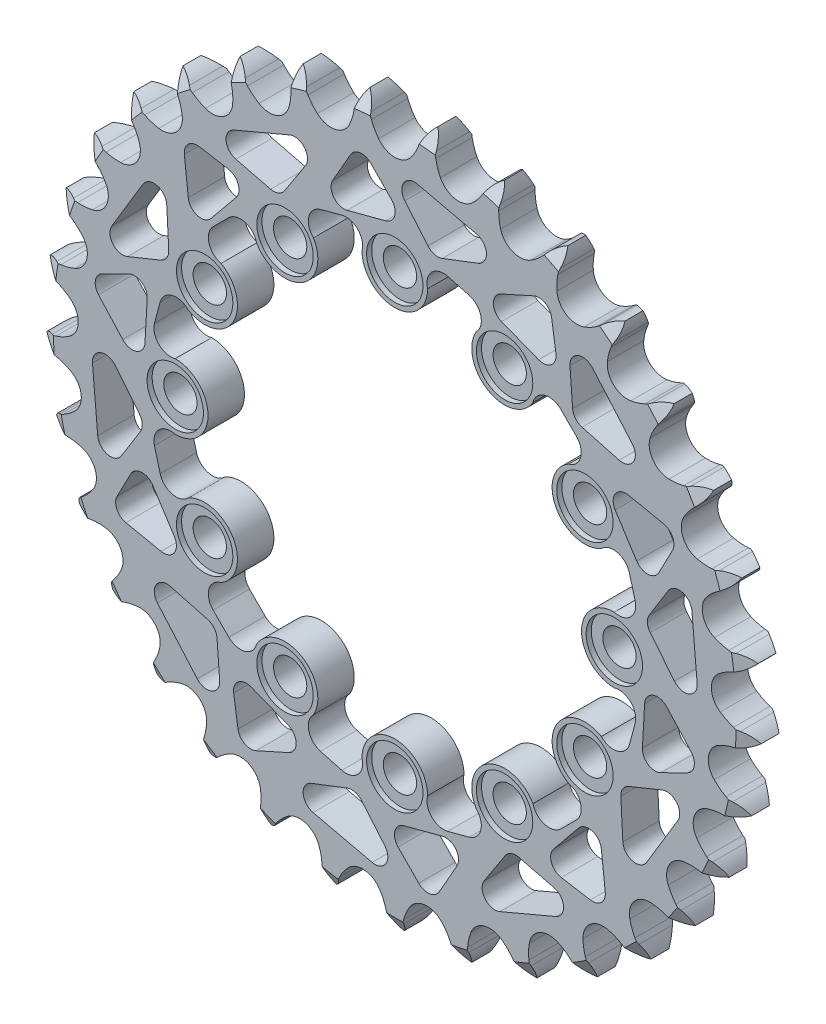
from build123d import *

# Parameters (mm, degrees)
EXTRUSION_DEPTH         = 7.2136
CIRPATTERN1_COUNT       = 12
CUT_EXTRUDE1_DEPTH      = 101.397293257
CUT_EXTRUDE1_DEPTH_BACK = 101.397293257
SKETCH8_R               = 37
CUT_EXTRUDE2_START      = 7.2136
SKETCH10_R              = 5.588
CUT_EXTRUDE2_DEPTH      = 1.016
CIRPATTERN2_COUNT       = 12
CUT_EXTRUDE3_DEPTH      = 101.397293405
CIRPATTERN3_COUNT       = 12
CUT_EXTRUDE4_DEPTH      = 101.397293405
CIRPATTERN5_COUNT       = 10


with BuildPart() as part:
    # Teeth Sketch → Extrusion (new body)
    with BuildSketch(Plane.XY):
        with BuildLine():
            ThreePointArc((6.734552875, 70.527428506), (5.727412099, 69.369502295), (5.022388138, 68.006393031))
            Line((5.022388138, 68.006393031), (4.635162245, 66.971544668))
            ThreePointArc((4.635162245, 66.971544668), (4.0137299, 65.635158722), (3.209237245, 64.400291471))
            ThreePointArc((3.209237245, 64.400291471), (0, 62.793862006), (-3.209237245, 64.400291471))
            ThreePointArc((-3.209237245, 64.400291471), (-4.0137299, 65.635158722), (-4.635162245, 66.971544668))
            Line((-4.635162245, 66.971544668), (-5.022388138, 68.006393031))
            ThreePointArc((-5.022388138, 68.006393031), (-5.727412099, 69.369502295), (-6.734552875, 70.527428506))
            ThreePointArc((-6.734552875, 70.527428506), (-7.504354329, 69.199824885), (-7.938667464, 67.727922119))
            Line((-7.938667464, 67.727922119), (-8.123049341, 66.638491832))
            ThreePointArc((-8.123049341, 66.638491832), (-8.48033889, 65.208649276), (-9.036593151, 63.84384645))
            ThreePointArc((-9.036593151, 63.84384645), (-11.883816523, 61.659095115), (-15.339077445, 62.629142165))
            ThreePointArc((-15.339077445, 62.629142165), (-16.362732034, 63.68944252), (-17.22584699, 64.884071387))
            Line((-17.22584699, 64.884071387), (-17.801921547, 65.826935709))
            ThreePointArc((-17.801921547, 65.826935709), (-18.752174931, 67.031985151), (-19.960254337, 67.978383482))
            ThreePointArc((-19.960254337, 67.978383482), (-20.464893839, 66.529085505), (-20.61279894, 65.001587639))
            Line((-20.61279894, 65.001587639), (-20.587672758, 63.896950277))
            ThreePointArc((-20.587672758, 63.896950277), (-20.667906137, 62.425329346), (-20.955817525, 60.979918474))
            ThreePointArc((-20.955817525, 60.979918474), (-23.338120953, 58.295807876), (-26.914523421, 58.594412483))
            ThreePointArc((-26.914523421, 58.594412483), (-28.120342399, 59.441823925), (-29.193944743, 60.451518712))
            Line((-29.193944743, 60.451518712), (-29.938047129, 61.268321421))
            ThreePointArc((-29.938047129, 61.268321421), (-31.099185303, 62.271757414), (-32.464540202, 62.972422563))
            ThreePointArc((-32.464540202, 62.972422563), (-32.685778765, 61.453811636), (-32.541930156, 59.925926421))
            Line((-32.541930156, 59.925926421), (-32.308204042, 58.846006456))
            ThreePointArc((-32.308204042, 58.846006456), (-32.108481407, 57.385795366), (-32.117644055, 55.912017363))
            ThreePointArc((-32.117644055, 55.912017363), (-33.948924886, 52.825558252), (-37.517208396, 52.441928068))
            ThreePointArc((-37.517208396, 52.441928068), (-38.861610323, 53.045822938), (-40.106897269, 53.834090646))
            Line((-40.106897269, 53.834090646), (-40.992133685, 54.495310364))
            ThreePointArc((-40.992133685, 54.495310364), (-42.32219009, 55.260866117), (-43.795472998, 55.69047422))
            ThreePointArc((-43.795472998, 55.69047422), (-43.725314484, 54.157436897), (-43.294911229, 52.684386087))
            Line((-43.294911229, 52.684386087), (-42.861032653, 51.668214641))
            ThreePointArc((-42.861032653, 51.668214641), (-42.388572501, 50.272189225), (-42.118655247, 48.823310267))
            ThreePointArc((-42.118655247, 48.823310267), (-43.33272622, 45.446055318), (-46.763923708, 44.394055736))
            ThreePointArc((-46.763923708, 44.394055736), (-48.198318397, 44.732607702), (-49.570282031, 45.270958281))
            Line((-49.570282031, 45.270958281), (-50.564657725, 45.752696804))
            ThreePointArc((-50.564657725, 45.752696804), (-52.015560657, 46.252703137), (-53.543523293, 46.395727039))
            ThreePointArc((-53.543523293, 46.395727039), (-53.184503413, 44.903671283), (-52.483101407, 43.538694772))
            Line((-52.483101407, 43.538694772), (-51.864751871, 42.622998928))
            ThreePointArc((-51.864751871, 42.622998928), (-51.136630142, 41.341615182), (-50.597388499, 39.970001531))
            ThreePointArc((-50.597388499, 39.970001531), (-51.150369926, 36.424013535), (-54.320468976, 34.741666562))
            ThreePointArc((-54.320468976, 34.741666562), (-55.793013665, 34.802639473), (-57.242067645, 35.071615531))
            Line((-57.242067645, 35.071615531), (-58.309643291, 35.356461573))
            ThreePointArc((-58.309643291, 35.356461573), (-59.828953337, 35.572846956), (-61.356371149, 35.424117399))
            ThreePointArc((-61.356371149, 35.424117399), (-60.721465817, 34.026969994), (-59.774415556, 32.819401589))
            Line((-59.774415556, 32.819401589), (-58.993943824, 32.037276981))
            ThreePointArc((-58.993943824, 32.037276981), (-58.036476735, 30.916847451), (-57.2474003, 29.672072798))
            ThreePointArc((-57.2474003, 29.672072798), (-57.119305992, 26.085513002), (-59.913730964, 23.83362304))
            ThreePointArc((-59.913730964, 23.83362304), (-61.371204052, 23.614813176), (-62.844975793, 23.604693218))
            Line((-62.844975793, 23.604693218), (-63.947166423, 23.682351702))
            ThreePointArc((-63.947166423, 23.682351702), (-65.479971761, 23.607295402), (-66.951639889, 23.17218786))
            ThreePointArc((-66.951639889, 23.17218786), (-66.063796239, 21.920445353), (-64.905326586, 20.913929722))
            Line((-64.905326586, 20.913929722), (-63.99094094, 20.293644371))
            ThreePointArc((-63.99094094, 20.293644371), (-62.838733846, 19.374664301), (-61.828341898, 18.301718044))
            ThreePointArc((-61.828341898, 18.301718044), (-61.023801517, 14.804214063), (-63.341554612, 12.064170283))
            ThreePointArc((-63.341554612, 12.064170283), (-64.731279223, 11.573486003), (-66.176502774, 11.28463579))
            Line((-66.176502774, 11.28463579), (-67.273472348, 11.152299936))
            ThreePointArc((-67.273472348, 11.152299936), (-68.764373399, 10.788514683), (-70.127101923, 10.082755077))
            ThreePointArc((-70.127101923, 10.082755077), (-69.018408937, 9.021658703), (-67.690390004, 8.252573944))
            Line((-67.690390004, 8.252573944), (-66.675138724, 7.816546579))
            ThreePointArc((-66.675138724, 7.816546579), (-65.369835391, 7.132230303), (-64.174646128, 6.269891516))
            ThreePointArc((-64.174646128, 6.269891516), (-62.722737859, 2.987852256), (-64.480049441, -0.14131302))
            ThreePointArc((-64.480049441, -0.14131302), (-65.751797307, -0.886137108), (-67.116238523, -1.443277777))
            Line((-67.116238523, -1.443277777), (-68.168339704, -1.780825007))
            ThreePointArc((-68.168339704, -1.780825007), (-69.563451418, -2.420191065), (-70.767987779, -3.371094744))
            ThreePointArc((-70.767987779, -3.371094744), (-69.478516511, -4.203194198), (-68.028946362, -4.707051357))
            Line((-68.028946362, -4.707051357), (-66.949523274, -4.943061572))
            ThreePointArc((-66.949523274, -4.943061572), (-65.538300765, -5.367981082), (-64.201511441, -5.988545228))
            ThreePointArc((-64.201511441, -5.988545228), (-62.154711032, -8.936498316), (-63.288067282, -12.341688903))
            ThreePointArc((-63.288067282, -12.341688903), (-64.395874122, -13.313732915), (-65.630218543, -14.119027525))
            Line((-65.630218543, -14.119027525), (-66.599425651, -14.649586294))
            ThreePointArc((-66.599425651, -14.649586294), (-67.848325057, -15.541424803), (-68.851134172, -16.703104419))
            ThreePointArc((-68.851134172, -16.703104419), (-67.427489473, -17.276132709), (-65.908759351, -17.496551559))
            Line((-65.908759351, -17.496551559), (-64.804177617, -17.524014599))
            ThreePointArc((-64.804177617, -17.524014599), (-63.338041192, -17.674179644), (-61.907966855, -18.030540344))
            ThreePointArc((-61.907966855, -18.030540344), (-59.340251006, -20.537860555), (-59.808689476, -24.096003993))
            ThreePointArc((-59.808689476, -24.096003993), (-60.712516265, -25.260135726), (-61.772151467, -26.284478831))
            Line((-61.772151467, -26.284478831), (-62.623434833, -26.988873364))
            ThreePointArc((-62.623434833, -26.988873364), (-63.680983452, -28.100950955), (-64.445821187, -29.43142038))
            ThreePointArc((-64.445821187, -29.43142038), (-62.939457285, -29.724666771), (-61.406458053, -29.6536808))
            Line((-61.406458053, -29.6536808), (-60.316640136, -29.471604079))
            ThreePointArc((-60.316640136, -29.471604079), (-58.848579784, -29.341587304), (-57.376907048, -29.420864754))
            ThreePointArc((-57.376907048, -29.420864754), (-54.381079699, -31.396931003), (-54.167669802, -34.979426717))
            ThreePointArc((-54.167669802, -34.979426717), (-54.834849884, -36.293571418), (-55.681477891, -37.499940589))
            Line((-55.681477891, -37.499940589), (-56.384069915, -38.352712231))
            ThreePointArc((-56.384069915, -38.352712231), (-57.212045185, -39.644835523), (-57.711268312, -41.096008126))
            ThreePointArc((-57.711268312, -41.096008126), (-56.176629123, -41.09887393), (-54.684767369, -40.739048756))
            Line((-54.684767369, -40.739048756), (-53.649102126, -40.354013001))
            ThreePointArc((-53.649102126, -40.354013001), (-52.232177374, -39.94851355), (-50.772096325, -39.747842457))
            ThreePointArc((-50.772096325, -39.747842457), (-47.456434483, -41.12123456), (-46.56888941, -44.598601821))
            ThreePointArc((-46.56888941, -44.598601821), (-46.975309158, -46.015262876), (-47.578330627, -47.360056788))
            Line((-47.578330627, -47.360056788), (-48.106837804, -48.330384151))
            ThreePointArc((-48.106837804, -48.330384151), (-48.675314541, -49.755852442), (-48.890879835, -51.275279063))
            ThreePointArc((-48.890879835, -51.275279063), (-47.383431219, -50.987660703), (-45.986626711, -50.352001344))
            Line((-45.986626711, -50.352001344), (-45.042545785, -49.777922752))
            ThreePointArc((-45.042545785, -49.777922752), (-43.727967985, -49.111596431), (-42.332249756, -48.638229571))
            ThreePointArc((-42.332249756, -48.638229571), (-38.816590078, -49.35930956), (-37.28698802, -52.605867255))
            ThreePointArc((-37.28698802, -52.605867255), (-37.417958367, -54.073842843), (-37.75557853, -55.50845714))
            Line((-37.75557853, -55.50845714), (-38.090899233, -56.561270064))
            ThreePointArc((-38.090899233, -56.561270064), (-38.379331208, -58.068563217), (-38.303447577, -59.601327819))
            ThreePointArc((-38.303447577, -59.601327819), (-36.877672653, -59.03362057), (-35.626409548, -58.145101414))
            Line((-35.626409548, -58.145101414), (-34.808034481, -57.402728679))
            ThreePointArc((-34.808034481, -57.402728679), (-33.6433159, -56.499658259), (-32.362405386, -55.770704343))
            ThreePointArc((-32.362405386, -55.770704343), (-28.773812973, -55.813410509), (-26.657437732, -58.711819583))
            ThreePointArc((-26.657437732, -58.711819583), (-26.508225068, -60.178053241), (-26.568241455, -61.650637225))
            Line((-26.568241455, -61.650637225), (-26.69825632, -62.747884308))
            ThreePointArc((-26.69825632, -62.747884308), (-26.696218847, -64.28252482), (-26.331628924, -65.773229298))
            ThreePointArc((-26.331628924, -65.773229298), (-25.039058915, -64.94595158), (-23.978561119, -63.836686022))
            Line((-23.978561119, -63.836686022), (-23.31547012, -62.952850431))
            ThreePointArc((-23.31547012, -62.952850431), (-22.342706722, -61.845675228), (-21.222899365, -60.887480551))
            ThreePointArc((-21.222899365, -60.887480551), (-17.691075297, -60.250269381), (-15.06441819, -62.69577378))
            ThreePointArc((-15.06441819, -62.69577378), (-14.640415448, -64.107272002), (-14.42065891, -65.564602652))
            Line((-14.42065891, -65.564602652), (-14.340668861, -66.666626525))
            ThreePointArc((-14.340668861, -66.666626525), (-14.048235582, -68.17314849), (-13.408116596, -69.567914899))
            ThreePointArc((-13.408116596, -69.567914899), (-12.295468348, -68.510966685), (-11.464065017, -67.221046473))
            Line((-11.464065017, -67.221046473), (-10.980223921, -66.227692145))
            ThreePointArc((-10.980223921, -66.227692145), (-10.23457391, -64.956428358), (-9.316342465, -63.80362457))
            ThreePointArc((-9.316342465, -63.80362457), (-5.968936066, -62.509526537), (-2.926931324, -64.413739359))
            ThreePointArc((-2.926931324, -64.413739359), (-2.24346307, -65.719486924), (-1.751876179, -67.108892511))
            Line((-1.751876179, -67.108892511), (-1.464772265, -68.175863162))
            ThreePointArc((-1.464772265, -68.175863162), (-0.89251248, -69.59981695), (0, -70.848234798))
            ThreePointArc((0, -70.848234798), (0.89251248, -69.59981695), (1.464772265, -68.175863162))
            Line((1.464772265, -68.175863162), (1.751876179, -67.108892511))
            ThreePointArc((1.751876179, -67.108892511), (2.24346307, -65.719486924), (2.926931324, -64.413739359))
            ThreePointArc((2.926931324, -64.413739359), (5.968936066, -62.509526537), (9.316342465, -63.80362457))
            ThreePointArc((9.316342465, -63.80362457), (10.23457391, -64.956428358), (10.980223921, -66.227692145))
            Line((10.980223921, -66.227692145), (11.464065017, -67.221046473))
            ThreePointArc((11.464065017, -67.221046473), (12.295468348, -68.510966685), (13.408116596, -69.567914899))
            ThreePointArc((13.408116596, -69.567914899), (14.048235582, -68.17314849), (14.340668861, -66.666626525))
            Line((14.340668861, -66.666626525), (14.42065891, -65.564602652))
            ThreePointArc((14.42065891, -65.564602652), (14.640415448, -64.107272002), (15.06441819, -62.69577378))
            ThreePointArc((15.06441819, -62.69577378), (17.691075297, -60.250269381), (21.222899365, -60.887480551))
            ThreePointArc((21.222899365, -60.887480551), (22.342706722, -61.845675228), (23.31547012, -62.952850431))
            Line((23.31547012, -62.952850431), (23.978561119, -63.836686022))
            ThreePointArc((23.978561119, -63.836686022), (25.039058915, -64.94595158), (26.331628924, -65.773229298))
            ThreePointArc((26.331628924, -65.773229298), (26.696218847, -64.28252482), (26.69825632, -62.747884308))
            Line((26.69825632, -62.747884308), (26.568241455, -61.650637225))
            ThreePointArc((26.568241455, -61.650637225), (26.508225068, -60.178053241), (26.657437732, -58.711819583))
            ThreePointArc((26.657437732, -58.711819583), (28.773812973, -55.813410509), (32.362405386, -55.770704343))
            ThreePointArc((32.362405386, -55.770704343), (33.6433159, -56.499658259), (34.808034481, -57.402728679))
            Line((34.808034481, -57.402728679), (35.626409548, -58.145101414))
            ThreePointArc((35.626409548, -58.145101414), (36.877672653, -59.03362057), (38.303447577, -59.601327819))
            ThreePointArc((38.303447577, -59.601327819), (38.379331208, -58.068563217), (38.090899233, -56.561270064))
            Line((38.090899233, -56.561270064), (37.75557853, -55.50845714))
            ThreePointArc((37.75557853, -55.50845714), (37.417958367, -54.073842843), (37.28698802, -52.605867255))
            ThreePointArc((37.28698802, -52.605867255), (38.816590078, -49.35930956), (42.332249756, -48.638229571))
            ThreePointArc((42.332249756, -48.638229571), (43.727967985, -49.111596431), (45.042545785, -49.777922752))
            Line((45.042545785, -49.777922752), (45.986626711, -50.352001344))
            ThreePointArc((45.986626711, -50.352001344), (47.383431219, -50.987660703), (48.890879835, -51.275279063))
            ThreePointArc((48.890879835, -51.275279063), (48.675314541, -49.755852442), (48.106837804, -48.330384151))
            Line((48.106837804, -48.330384151), (47.578330627, -47.360056788))
            ThreePointArc((47.578330627, -47.360056788), (46.975309158, -46.015262876), (46.56888941, -44.598601821))
            ThreePointArc((46.56888941, -44.598601821), (47.456434483, -41.12123456), (50.772096325, -39.747842457))
            ThreePointArc((50.772096325, -39.747842457), (52.232177374, -39.94851355), (53.649102126, -40.354013001))
            Line((53.649102126, -40.354013001), (54.684767369, -40.739048756))
            ThreePointArc((54.684767369, -40.739048756), (56.176629123, -41.09887393), (57.711268312, -41.096008126))
            ThreePointArc((57.711268312, -41.096008126), (57.212045185, -39.644835523), (56.384069915, -38.352712231))
            Line((56.384069915, -38.352712231), (55.681477891, -37.499940589))
            ThreePointArc((55.681477891, -37.499940589), (54.834849884, -36.293571418), (54.167669802, -34.979426717))
            ThreePointArc((54.167669802, -34.979426717), (54.381079699, -31.396931003), (57.376907048, -29.420864754))
            ThreePointArc((57.376907048, -29.420864754), (58.848579784, -29.341587304), (60.316640136, -29.471604079))
            Line((60.316640136, -29.471604079), (61.406458053, -29.6536808))
            ThreePointArc((61.406458053, -29.6536808), (62.939457285, -29.724666771), (64.445821187, -29.43142038))
            ThreePointArc((64.445821187, -29.43142038), (63.680983452, -28.100950955), (62.623434833, -26.988873364))
            Line((62.623434833, -26.988873364), (61.772151467, -26.284478831))
            ThreePointArc((61.772151467, -26.284478831), (60.712516265, -25.260135726), (59.808689476, -24.096003993))
            ThreePointArc((59.808689476, -24.096003993), (59.340251006, -20.537860555), (61.907966855, -18.030540344))
            ThreePointArc((61.907966855, -18.030540344), (63.338041192, -17.674179644), (64.804177617, -17.524014599))
            Line((64.804177617, -17.524014599), (65.908759351, -17.496551559))
            ThreePointArc((65.908759351, -17.496551559), (67.427489473, -17.276132709), (68.851134172, -16.703104419))
            ThreePointArc((68.851134172, -16.703104419), (67.848325057, -15.541424803), (66.599425651, -14.649586294))
            Line((66.599425651, -14.649586294), (65.630218543, -14.119027525))
            ThreePointArc((65.630218543, -14.119027525), (64.395874122, -13.313732915), (63.288067282, -12.341688903))
            ThreePointArc((63.288067282, -12.341688903), (62.154711032, -8.936498316), (64.201511441, -5.988545228))
            ThreePointArc((64.201511441, -5.988545228), (65.538300765, -5.367981082), (66.949523274, -4.943061572))
            Line((66.949523274, -4.943061572), (68.028946362, -4.707051357))
            ThreePointArc((68.028946362, -4.707051357), (69.478516511, -4.203194198), (70.767987779, -3.371094744))
            ThreePointArc((70.767987779, -3.371094744), (69.563451418, -2.420191065), (68.168339704, -1.780825007))
            Line((68.168339704, -1.780825007), (67.116238523, -1.443277777))
            ThreePointArc((67.116238523, -1.443277777), (65.751797307, -0.886137108), (64.480049441, -0.14131302))
            ThreePointArc((64.480049441, -0.14131302), (62.722737859, 2.987852256), (64.174646128, 6.269891516))
            ThreePointArc((64.174646128, 6.269891516), (65.369835391, 7.132230303), (66.675138724, 7.816546579))
            Line((66.675138724, 7.816546579), (67.690390004, 8.252573944))
            ThreePointArc((67.690390004, 8.252573944), (69.018408937, 9.021658703), (70.127101923, 10.082755077))
            ThreePointArc((70.127101923, 10.082755077), (68.764373399, 10.788514683), (67.273472348, 11.152299936))
            Line((67.273472348, 11.152299936), (66.176502774, 11.28463579))
            ThreePointArc((66.176502774, 11.28463579), (64.731279223, 11.573486003), (63.341554612, 12.064170283))
            ThreePointArc((63.341554612, 12.064170283), (61.023801517, 14.804214063), (61.828341898, 18.301718044))
            ThreePointArc((61.828341898, 18.301718044), (62.838733846, 19.374664301), (63.99094094, 20.293644371))
            Line((63.99094094, 20.293644371), (64.905326586, 20.913929722))
            ThreePointArc((64.905326586, 20.913929722), (66.063796239, 21.920445353), (66.951639889, 23.17218786))
            ThreePointArc((66.951639889, 23.17218786), (65.479971761, 23.607295402), (63.947166423, 23.682351702))
            Line((63.947166423, 23.682351702), (62.844975793, 23.604693218))
            ThreePointArc((62.844975793, 23.604693218), (61.371204052, 23.614813176), (59.913730964, 23.83362304))
            ThreePointArc((59.913730964, 23.83362304), (57.119305992, 26.085513002), (57.2474003, 29.672072798))
            ThreePointArc((57.2474003, 29.672072798), (58.036476735, 30.916847451), (58.993943824, 32.037276981))
            Line((58.993943824, 32.037276981), (59.774415556, 32.819401589))
            ThreePointArc((59.774415556, 32.819401589), (60.721465817, 34.026969994), (61.356371149, 35.424117399))
            ThreePointArc((61.356371149, 35.424117399), (59.828953337, 35.572846956), (58.309643291, 35.356461573))
            Line((58.309643291, 35.356461573), (57.242067645, 35.071615531))
            ThreePointArc((57.242067645, 35.071615531), (55.793013665, 34.802639473), (54.320468976, 34.741666562))
            ThreePointArc((54.320468976, 34.741666562), (51.150369926, 36.424013535), (50.597388499, 39.970001531))
            ThreePointArc((50.597388499, 39.970001531), (51.136630142, 41.341615182), (51.864751871, 42.622998928))
            Line((51.864751871, 42.622998928), (52.483101407, 43.538694772))
            ThreePointArc((52.483101407, 43.538694772), (53.184503413, 44.903671283), (53.543523293, 46.395727039))
            ThreePointArc((53.543523293, 46.395727039), (52.015560657, 46.252703137), (50.564657725, 45.752696804))
            Line((50.564657725, 45.752696804), (49.570282031, 45.270958281))
            ThreePointArc((49.570282031, 45.270958281), (48.198318397, 44.732607702), (46.763923708, 44.394055736))
            ThreePointArc((46.763923708, 44.394055736), (43.33272622, 45.446055318), (42.118655247, 48.823310267))
            ThreePointArc((42.118655247, 48.823310267), (42.388572501, 50.272189225), (42.861032653, 51.668214641))
            Line((42.861032653, 51.668214641), (43.294911229, 52.684386087))
            ThreePointArc((43.294911229, 52.684386087), (43.725314484, 54.157436897), (43.795472998, 55.69047422))
            ThreePointArc((43.795472998, 55.69047422), (42.32219009, 55.260866117), (40.992133685, 54.495310364))
            Line((40.992133685, 54.495310364), (40.106897269, 53.834090646))
            ThreePointArc((40.106897269, 53.834090646), (38.861610323, 53.045822938), (37.517208396, 52.441928068))
            ThreePointArc((37.517208396, 52.441928068), (33.948924886, 52.825558252), (32.117644055, 55.912017363))
            ThreePointArc((32.117644055, 55.912017363), (32.108481407, 57.385795366), (32.308204042, 58.846006456))
            Line((32.308204042, 58.846006456), (32.541930156, 59.925926421))
            ThreePointArc((32.541930156, 59.925926421), (32.685778765, 61.453811636), (32.464540202, 62.972422563))
            ThreePointArc((32.464540202, 62.972422563), (31.099185303, 62.271757414), (29.938047129, 61.268321421))
            Line((29.938047129, 61.268321421), (29.193944743, 60.451518712))
            ThreePointArc((29.193944743, 60.451518712), (28.120342399, 59.441823925), (26.914523421, 58.594412483))
            ThreePointArc((26.914523421, 58.594412483), (23.338120953, 58.295807876), (20.955817525, 60.979918474))
            ThreePointArc((20.955817525, 60.979918474), (20.667906137, 62.425329346), (20.587672758, 63.896950277))
            Line((20.587672758, 63.896950277), (20.61279894, 65.001587639))
            ThreePointArc((20.61279894, 65.001587639), (20.464893839, 66.529085505), (19.960254337, 67.978383482))
            ThreePointArc((19.960254337, 67.978383482), (18.752174931, 67.031985151), (17.801921547, 65.826935709))
            Line((17.801921547, 65.826935709), (17.22584699, 64.884071387))
            ThreePointArc((17.22584699, 64.884071387), (16.362732034, 63.68944252), (15.339077445, 62.629142165))
            ThreePointArc((15.339077445, 62.629142165), (11.883816523, 61.659095115), (9.036593151, 63.84384645))
            ThreePointArc((9.036593151, 63.84384645), (8.48033889, 65.208649276), (8.123049341, 66.638491832))
            Line((8.123049341, 66.638491832), (7.938667464, 67.727922119))
            ThreePointArc((7.938667464, 67.727922119), (7.504354329, 69.199824885), (6.734552875, 70.527428506))
        make_face()
    extrude(amount=EXTRUSION_DEPTH)

    # Sketch7 → M6 Clearance Hole1 (revolve, cut)
    with BuildSketch(Plane(origin=(0, 43.500000122, 0), x_dir=(0, 1, 0), z_dir=(1, 0, 0))):
        Polygon((0, 0), (0, 19.254840043), (3.3, 17.272), (3.3, 0), align=None)
    m6_clearance_hole1 = revolve(axis=Axis((0, 43.500000122, -6.35), (0, 0, 1)), mode=Mode.SUBTRACT)

    # CirPattern1: M6 Clearance Hole1 ×12 about axis
    cirpattern1_axis = Axis((0, 0, 0), (0, 0, 1))
    for i in range(1, CIRPATTERN1_COUNT):
        add(m6_clearance_hole1.rotate(cirpattern1_axis, i * 360 / CIRPATTERN1_COUNT), mode=Mode.SUBTRACT)

    # Sketch8 → Cut-Extrude1 (cut, two sides: drawn at the far end of the back side and taken through both)
    with BuildSketch(Plane(origin=(0, 0, 0), x_dir=(-1, 0, 0), z_dir=(0, 0, -1)).offset(-CUT_EXTRUDE1_DEPTH_BACK)):
        Circle(SKETCH8_R)
    extrude(amount=CUT_EXTRUDE1_DEPTH + CUT_EXTRUDE1_DEPTH_BACK, mode=Mode.SUBTRACT)

    # Sketch5 → Cut-Revolve1 (revolve, cut)
    with BuildSketch(Plane(origin=(0, 0, 0), x_dir=(0, 0, -1), z_dir=(1, 0, 0))):
        Polygon((-7.2136, -67.654652666), (-7.2136, -70.848234798), (-5.3848, -70.848234798), align=None)
    cut_revolve1 = revolve(axis=Axis((0, 0, 7.2136), (0, 0, -1)), mode=Mode.SUBTRACT)

    # Mirror1: Cut-Revolve1 across plane
    add(cut_revolve1.mirror(Plane.XY.offset(3.6068)), mode=Mode.SUBTRACT)

    # Sketch10 → Cut-Extrude2 (cut)
    with BuildSketch(Plane.XY.offset(CUT_EXTRUDE2_START)):
        with Locations((-43.500000122, 0)):
            Circle(SKETCH10_R)
    cut_extrude2 = extrude(amount=-CUT_EXTRUDE2_DEPTH, mode=Mode.SUBTRACT)

    # CirPattern2: Cut-Extrude2 ×12 about axis
    cirpattern2_axis = Axis((0, 0, 0), (0, 0, 1))
    for i in range(1, CIRPATTERN2_COUNT):
        add(cut_extrude2.rotate(cirpattern2_axis, i * 360 / CIRPATTERN2_COUNT), mode=Mode.SUBTRACT)

    # Sketch12 → Cut-Extrude3 (cut, through all)
    with BuildSketch(Plane.XY.offset(7.2136)):
        with BuildLine():
            Line((10.487097713, 47.626416507), (14.731115222, 46.489235443))
            ThreePointArc((14.731115222, 46.489235443), (17.043665703, 44.109493558), (16.120834831, 40.922105231))
            ThreePointArc((16.120834831, 40.922105231), (15.471482072, 35.989781346), (18.5, 32.04293994))
            ThreePointArc((18.5, 32.04293994), (9.576304669, 35.739255573), (0, 37))
            ThreePointArc((0, 37), (4.596194164, 38.903805958), (6.500000122, 43.500000122))
            ThreePointArc((6.500000122, 43.500000122), (7.294499307, 46.721774821), (10.487097713, 47.626416507))
        make_face()
    cut_extrude3 = extrude(amount=-CUT_EXTRUDE3_DEPTH, mode=Mode.SUBTRACT)

    # CirPattern3: Cut-Extrude3 ×12 about axis
    cirpattern3_axis = Axis((0, 0, 0), (0, 0, 1))
    for i in range(1, CIRPATTERN3_COUNT):
        add(cut_extrude3.rotate(cirpattern3_axis, i * 360 / CIRPATTERN3_COUNT), mode=Mode.SUBTRACT)

    # Sketch13 → Cut-Extrude4 (cut, through all)
    with BuildSketch(Plane.XY.offset(7.2136)):
        with BuildLine():
            Line((-12.29503781, 52.699348233), (-8.766956721, 58.874555746))
            ThreePointArc((-8.766956721, 58.874555746), (-6.886929375, 60.133596514), (-4.748676784, 59.393621964))
            Line((-4.748676784, 59.393621964), (-0.656757873, 55.224069994))
            ThreePointArc((-0.656757873, 55.224069994), (-0.020757561, 52.770631729), (-1.823075281, 50.988636624))
            Line((-1.823075281, 50.988636624), (-9.443075281, 48.982981081))
            ThreePointArc((-9.443075281, 48.982981081), (-12.104647123, 49.892965008), (-12.29503781, 52.699348233))
        make_face()
        with BuildLine():
            Line((1.979717897, 56.320855635), (6.567308468, 50.886285113))
            ThreePointArc((6.567308468, 50.886285113), (7.875401815, 50.064805257), (9.417527045, 50.153050025))
            Line((9.417527045, 50.153050025), (16.53250792, 52.880951625))
            ThreePointArc((16.53250792, 52.880951625), (18.15709085, 55.428778294), (16.195570256, 57.727283763))
            Line((16.195570256, 57.727283763), (4.49299881, 60.433952684))
            ThreePointArc((4.49299881, 60.433952684), (1.753234812, 59.28365705), (1.979717897, 56.320855635))
        make_face()
    cut_extrude4 = extrude(amount=-CUT_EXTRUDE4_DEPTH, mode=Mode.SUBTRACT)

    # CirPattern5: Cut-Extrude4 ×10 about axis
    cirpattern5_axis = Axis((0, 0, 0), (0, 0, 1))
    for i in range(1, CIRPATTERN5_COUNT):
        add(cut_extrude4.rotate(cirpattern5_axis, i * 360 / CIRPATTERN5_COUNT), mode=Mode.SUBTRACT)


solid = part.part
